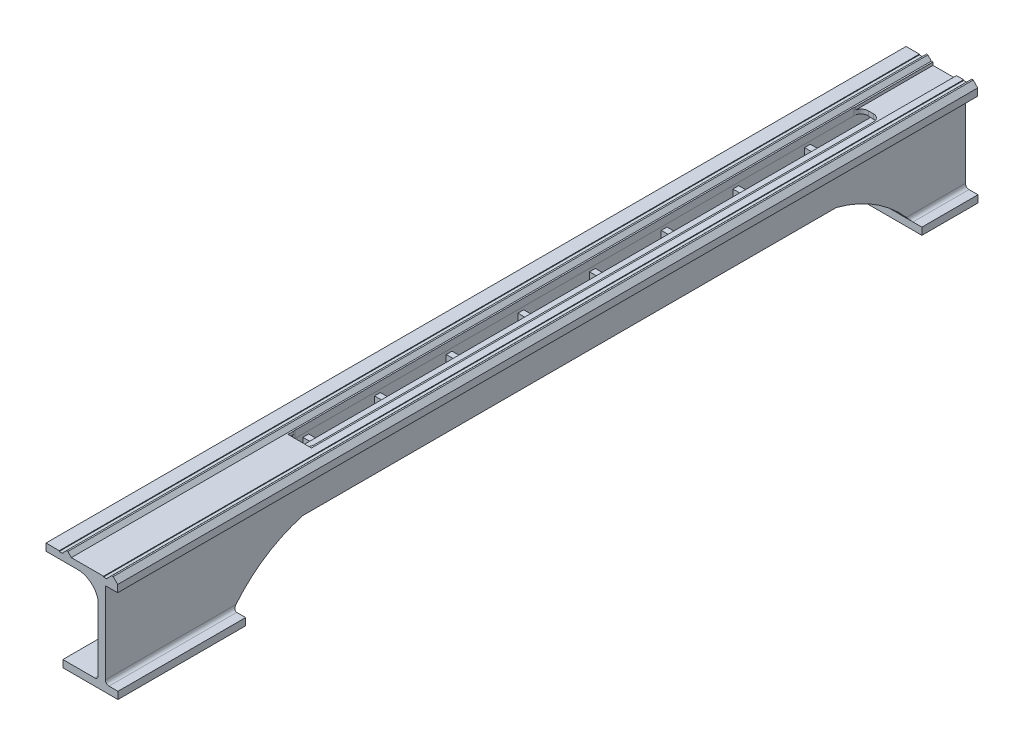
from build123d import *

# Parameters (mm, degrees)
BOSS_EXTRUDE1_DEPTH     = 1200
CUT_EXTRUDE1_DEPTH      = 800
CUT_EXTRUDE2_START      = -300
SKETCH3_W               = 32.854587933
SKETCH3_H               = 4.856765172
CUT_EXTRUDE2_DEPTH      = 900
SKETCH5_W               = 6.380456207
SKETCH5_H               = 118.355566626
BOSS_EXTRUDE2_DEPTH     = 1100
SKETCH6_W               = 8.096006647
SKETCH6_H               = 64.029540506
BOSS_EXTRUDE3_DEPTH     = 50
LPATTERN1_COUNT         = 10
LPATTERN1_PITCH         = 100
CUT_EXTRUDE3_DEPTH      = 10
CUT_EXTRUDE3_DEPTH_BACK = 100


with BuildPart() as part:
    # Sketch1 → Boss-Extrude1 (new body)
    with BuildSketch(Plane.XY):
        with BuildLine():
            Line((-31.555119126, 31.290150882), (-37.853807036, 37.718722311))
            Line((-37.853807036, 37.718722311), (-39.853807036, 37.718722311))
            Line((-39.853807036, 37.718722311), (-46.282378465, 31.420034401))
            Line((-46.282378465, 31.420034401), (-46.282378465, 30.420034401))
            Line((-46.282378465, 30.420034401), (-51.282378465, 30.420034401))
            Line((-51.282378465, 30.420034401), (-51.282378465, 31.420034401))
            Line((-51.282378465, 31.420034401), (-96.206307824, 31.420034401))
            Line((-96.206307824, 31.420034401), (-101.105287309, 36.420034401))
            Line((-101.105287309, 36.420034401), (-103.105287309, 36.420034401))
            Line((-103.105287309, 36.420034401), (-108.055034777, 31.470286932))
            Line((-108.055034777, 31.470286932), (-108.055034777, 30.420034401))
            Line((-108.055034777, 30.420034401), (-113.055034777, 30.420034401))
            Line((-113.055034777, 30.420034401), (-113.055034777, 31.420034401))
            Line((-113.055034777, 31.420034401), (-131.555034777, 31.420034401))
            Line((-131.555034777, 31.420034401), (-131.555034777, 21.420034401))
            Line((-131.555034777, 21.420034401), (-87.349569261, 21.420034401))
            ThreePointArc((-87.349569261, 21.420034401), (-68.862935324, 14.835575372), (-58.701074529, -1.95273366))
            Line((-58.701074529, -1.95273366), (-58.701074529, -92.579965599))
            ThreePointArc((-58.701074529, -92.579965599), (-60.165540623, -96.115499505), (-63.701074529, -97.579965599))
            Line((-63.701074529, -97.579965599), (-108.009983562, -97.579965599))
            Line((-108.009983562, -97.579965599), (-108.009983562, -107.579965599))
            Line((-108.009983562, -107.579965599), (-31.195424592, -107.579965599))
            Line((-31.195424592, -107.579965599), (-31.195424592, -97.579965599))
            Line((-31.195424592, -97.579965599), (-43.701074529, -97.579965599))
            ThreePointArc((-43.701074529, -97.579965599), (-47.236608435, -96.115499505), (-48.701074529, -92.579965599))
            Line((-48.701074529, -92.579965599), (-48.701074529, 21.290150882))
            Line((-48.701074529, 21.290150882), (-31.555119126, 21.290150882))
            Line((-31.555119126, 21.290150882), (-31.555119126, 31.290150882))
        make_face()
    extrude(amount=BOSS_EXTRUDE1_DEPTH)

    # Sketch2 → Cut-Extrude1 (cut)
    with BuildSketch(Plane(origin=(0, 20.764722339, 0), x_dir=(1, 0, 0), z_dir=(0, 1, 0))):
        with BuildLine():
            Line((-84.170689991, -100), (-77.170689991, -100))
            ThreePointArc((-77.170689991, -100), (-70.099622179, -102.928932188), (-67.170689991, -110))
            Line((-67.170689991, -110), (-67.170689991, -890))
            ThreePointArc((-67.170689991, -890), (-70.099622179, -897.071067812), (-77.170689991, -900))
            Line((-77.170689991, -900), (-84.170689991, -900))
            ThreePointArc((-84.170689991, -900), (-91.241757803, -897.071067812), (-94.170689991, -890))
            Line((-94.170689991, -890), (-94.170689991, -110))
            ThreePointArc((-94.170689991, -110), (-91.241757803, -102.928932188), (-84.170689991, -100))
        make_face()
    extrude(amount=CUT_EXTRUDE1_DEPTH, mode=Mode.SUBTRACT)

    # Sketch3 → Cut-Extrude2 (cut)
    with BuildSketch(Plane.XY.offset(1200).offset(CUT_EXTRUDE2_START)):
        with Locations((-77.540218065, 29.748880781)):
            Rectangle(SKETCH3_W, SKETCH3_H)
    extrude(amount=-CUT_EXTRUDE2_DEPTH, mode=Mode.SUBTRACT)

    # Sketch5 → Boss-Extrude2 (add)
    with BuildSketch(Plane(origin=(0, 0, 0), x_dir=(-1, 0, 0), z_dir=(0, 0, -1))):
        with Locations((98.110047032, -31.38113167)):
            Rectangle(SKETCH5_W, SKETCH5_H)
    extrude(amount=-BOSS_EXTRUDE2_DEPTH)

    # Sketch6 → Boss-Extrude3 (add)
    with BuildSketch(Plane.ZY.offset(101.300275135)):
        with Locations((74.203555632, -15.430068515)):
            Rectangle(SKETCH6_W, SKETCH6_H)
    boss_extrude3 = extrude(amount=-BOSS_EXTRUDE3_DEPTH)

    # LPattern1: Boss-Extrude3 ×10
    with Locations(*[(0, 0, i * LPATTERN1_PITCH) for i in range(1, LPATTERN1_COUNT)]):
        add(boss_extrude3)

    # Sketch4 → Cut-Extrude3 (cut, two sides: drawn at the far end of the back side and taken through both)
    with BuildSketch(Plane(origin=(-31.555119126, 0, 0), x_dir=(0, 0, -1), z_dir=(1, 0, 0)).offset(-CUT_EXTRUDE3_DEPTH_BACK)):
        with BuildLine():
            Line((-1021.794598087, -97.579965599), (-1021.794598087, -107.579965599))
            Line((-1021.794598087, -107.579965599), (-1021.794598087, -177.956634241))
            Line((-1021.794598087, -177.956634241), (-78.251558955, -177.956634241))
            Line((-78.251558955, -177.956634241), (-78.251558955, -97.579965599))
            ThreePointArc((-78.251558955, -97.579965599), (-123.907312604, -56.541030376), (-180.068799532, -31.75132623))
            Line((-180.068799532, -31.75132623), (-924.318449906, -31.75132623))
            ThreePointArc((-924.318449906, -31.75132623), (-978.481028867, -56.633278154), (-1021.794598087, -97.579965599))
        make_face()
    extrude(amount=CUT_EXTRUDE3_DEPTH + CUT_EXTRUDE3_DEPTH_BACK, mode=Mode.SUBTRACT)


solid = part.part
